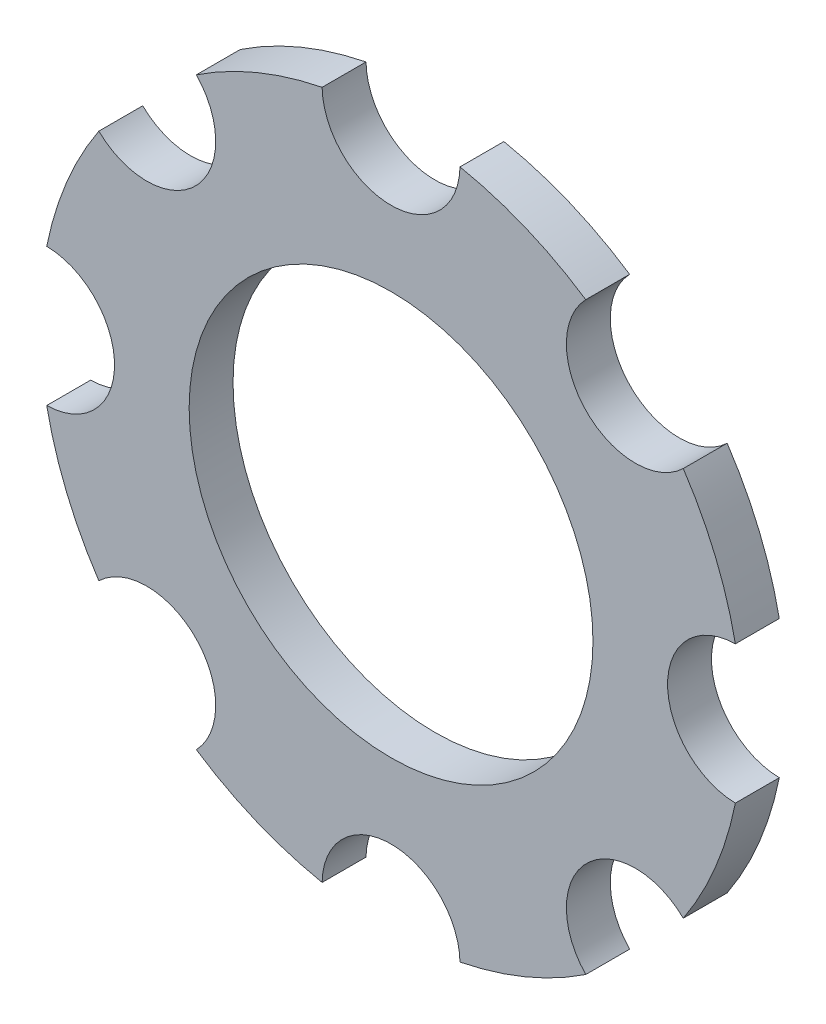
from build123d import *

# Parameters (mm, degrees)
SKETCH1_R          = 4
SKETCH1_R_2        = 2.3
BASE_EXTRUDE_DEPTH = 0.5
TYPEASLOT_DEPTH    = 10.383650549
TYPEAPATTERN_COUNT = 8


with BuildPart() as part:
    # Sketch1 → Base-Extrude (new body)
    with BuildSketch(Plane.XY):
        Circle(SKETCH1_R)
        Circle(SKETCH1_R_2, mode=Mode.SUBTRACT)
    extrude(amount=-BASE_EXTRUDE_DEPTH)

    # Sketch2 → TypeASlot (cut, through all)
    with BuildSketch(Plane(origin=(-3.136340101, -2.072523989, 0), x_dir=(1, 0, 0), z_dir=(0, 0, 1))):
        with BuildLine():
            Line((2.350942601, 16.007921489), (2.350942601, 6.007921489))
            ThreePointArc((2.350942601, 6.007921489), (3.136340101, 5.222523989), (3.921737601, 6.007921489))
            Line((3.921737601, 6.007921489), (3.921737601, 16.007921489))
            Line((3.921737601, 16.007921489), (2.350942601, 16.007921489))
        make_face()
    typeaslot = extrude(amount=-TYPEASLOT_DEPTH, mode=Mode.SUBTRACT)

    # TypeAPattern: TypeASlot ×8 about axis
    typeapattern_axis = Axis((0, 0, -0.5), (0, 0, 1))
    for i in range(1, TYPEAPATTERN_COUNT):
        add(typeaslot.rotate(typeapattern_axis, i * 360 / TYPEAPATTERN_COUNT), mode=Mode.SUBTRACT)


solid = part.part
